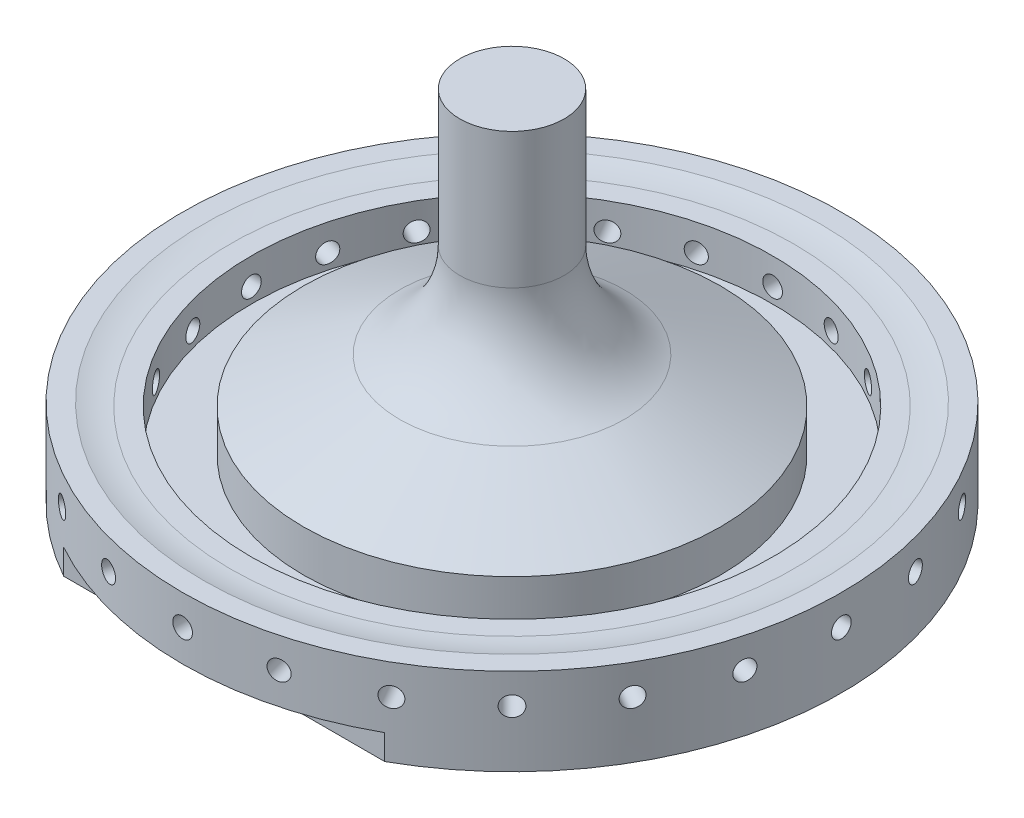
from build123d import *

# Parameters (mm, degrees)
HOLE_REACH         = 51.879
SKETCH2_R          = 0.6
HOLE_PATTERN_COUNT = 24
SKETCH3_W          = 25.4
SKETCH3_H          = 1.524
FLAT_DEPTH         = 2.54


with BuildPart() as part:
    # Sketch1 → Revolve1 (revolve)
    with BuildSketch(Plane.XY):
        with BuildLine():
            Line((0, 0), (3.175, 0))
            Line((3.175, 0), (3.175, -8.255))
            ThreePointArc((3.175, -8.255), (4.169464319, -11.666852513), (6.841374038, -14.010054448))
            Line((6.841374038, -14.010054448), (12.7, -16.7419766))
            Line((12.7, -16.7419766), (12.7, -19.2819766))
            Line((12.7, -19.2819766), (15.875, -19.2819766))
            Line((15.875, -19.2819766), (15.875, -16.7419766))
            Line((15.875, -16.7419766), (17.145, -16.7419766))
            ThreePointArc((17.145, -16.7419766), (17.973841321, -16.68765147), (18.788500936, -16.525605597))
            Line((18.788500936, -16.525605597), (20.058500936, -16.525605597))
            Line((20.058500936, -16.525605597), (20.058500936, -21.8219766))
            Line((20.058500936, -21.8219766), (0, -21.8219766))
            Line((0, -21.8219766), (0, 0))
        make_face()
    revolve(axis=Axis((0, 0, 0), (0, -1, 0)))

    # Sketch2 → Hole (cut, up to next)
    with BuildSketch(Plane.XY.offset(20.058500936), mode=Mode.PRIVATE) as hole_sk1:
        with Locations((0, -18.3644766)):
            Circle(SKETCH2_R)
    hole_tool1 = extrude(hole_sk1.sketch, amount=-HOLE_REACH, mode=Mode.PRIVATE) & part.part
    hole = hole_tool1.solids().sort_by_distance((0, -18.364477, 20.058501))[0]
    add(hole, mode=Mode.SUBTRACT)

    # Hole Pattern: Hole ×24 about axis
    hole_pattern_axis = Axis((0, -16.525605597, 0), (0, 1, 0))
    for i in range(1, HOLE_PATTERN_COUNT):
        add(hole.rotate(hole_pattern_axis, i * 360 / HOLE_PATTERN_COUNT), mode=Mode.SUBTRACT)

    # Sketch3 → Flat (cut)
    with BuildSketch(Plane.XY.offset(20.058500936)):
        with Locations((0, -21.0599766)):
            Rectangle(SKETCH3_W, SKETCH3_H)
    flat = extrude(amount=-FLAT_DEPTH, mode=Mode.SUBTRACT)

    # Flats: Flat across plane
    add(flat.mirror(Plane.XY), mode=Mode.SUBTRACT)


solid = part.part
